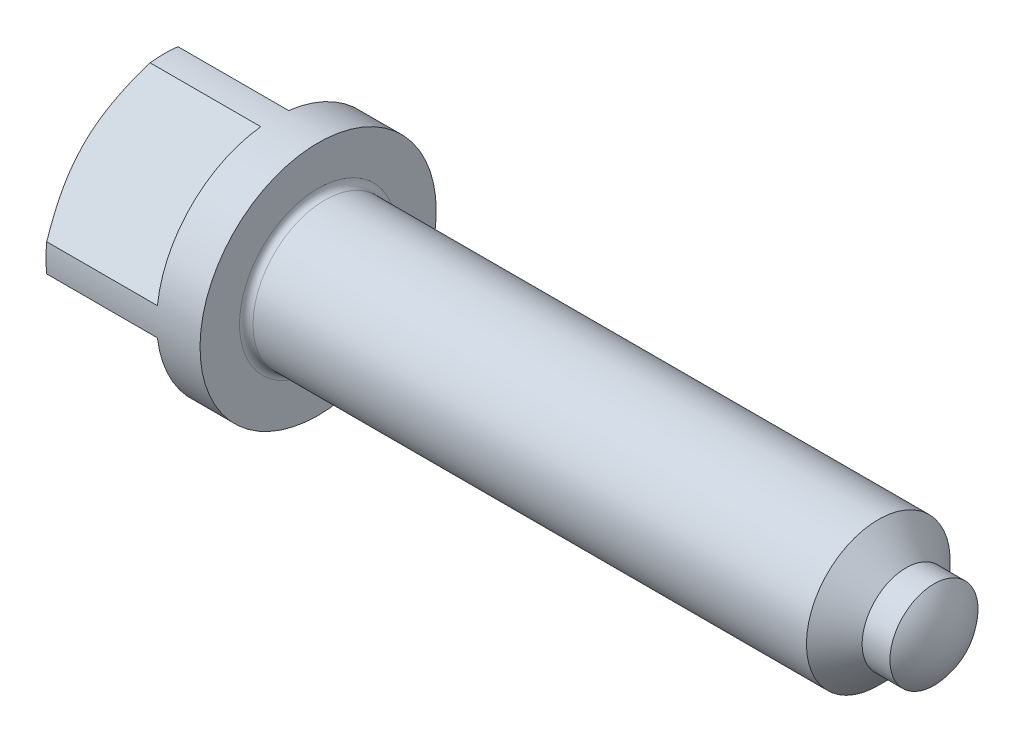
from build123d import *

# Parameters (mm, degrees)
BASEHEAD_DEPTH = 20
COLLAR_START   = -5.15
COLLARSKE_R    = 14
COLLAR_DEPTH   = 5.15
HEADFILLET_R   = 0.8


# Read off the part's stored shape, not the designer's step: HeadChamfer
with BuildPart() as part:
    # SquareSke → BaseHead (new body)
    with BuildSketch(Plane(origin=(0, 0, 0), x_dir=(0, 0, -1), z_dir=(1, 0, 0))):
        with BuildLine():
            Line((13.90189895, -1.654450236), (1.654450236, -13.90189895))
            ThreePointArc((1.654450236, -13.90189895), (0, -14), (-1.654450236, -13.90189895))
            Line((-1.654450236, -13.90189895), (-13.90189895, -1.654450236))
            ThreePointArc((-13.90189895, -1.654450236), (-14, 0), (-13.90189895, 1.654450236))
            Line((-13.90189895, 1.654450236), (-1.654450236, 13.90189895))
            ThreePointArc((-1.654450236, 13.90189895), (0, 14), (1.654450236, 13.90189895))
            Line((1.654450236, 13.90189895), (13.90189895, 1.654450236))
            ThreePointArc((13.90189895, 1.654450236), (14, 0), (13.90189895, -1.654450236))
        make_face()
    extrude(amount=BASEHEAD_DEPTH)

    # HeadChamfer outline → HeadChamfer (revolve, cut)
    with BuildSketch(Plane.YX):
        Polygon((14.000000007, 1.732050812), (11, 0), (14.000000007, 0), align=None)
    revolve(axis=Axis((0, 0, 0), (1, 0, 0)), mode=Mode.SUBTRACT)

    # HeadChamfer 2 outline → HeadChamfer 2 (revolve)
    with BuildSketch(Plane.YX):
        with BuildLine():
            Line((5.221450167, 89.7), (5.221450173, 92.999999995))
            ThreePointArc((5.221450173, 92.999999995), (2.79569052, 94.482893893), (0, 95))
            Line((0, 95), (0, 20))
            Line((0, 20), (8.520797289, 20))
            Line((8.520797289, 20), (8.520797289, 86.400652878))
            Line((8.520797289, 86.400652878), (5.221450167, 89.7))
        make_face()
    revolve(axis=Axis((0, 0, 0), (1, 0, 0)))

    # CollarSke → Collar (add)
    with BuildSketch(Plane(origin=(20, 0, 0), x_dir=(0, 0, -1), z_dir=(1, 0, 0)).offset(COLLAR_START)):
        with Locations(Location((0, 0, 0), (0, 0, 173.213210702))):
            Circle(COLLARSKE_R)
    extrude(amount=COLLAR_DEPTH)

    # HeadFillet
    headfillet_edges = [part.edges().sort_by_distance(p)[0] for p in [
        (20, -8.520797289, 0),
    ]]
    fillet(headfillet_edges, radius=HEADFILLET_R)


solid = part.part
